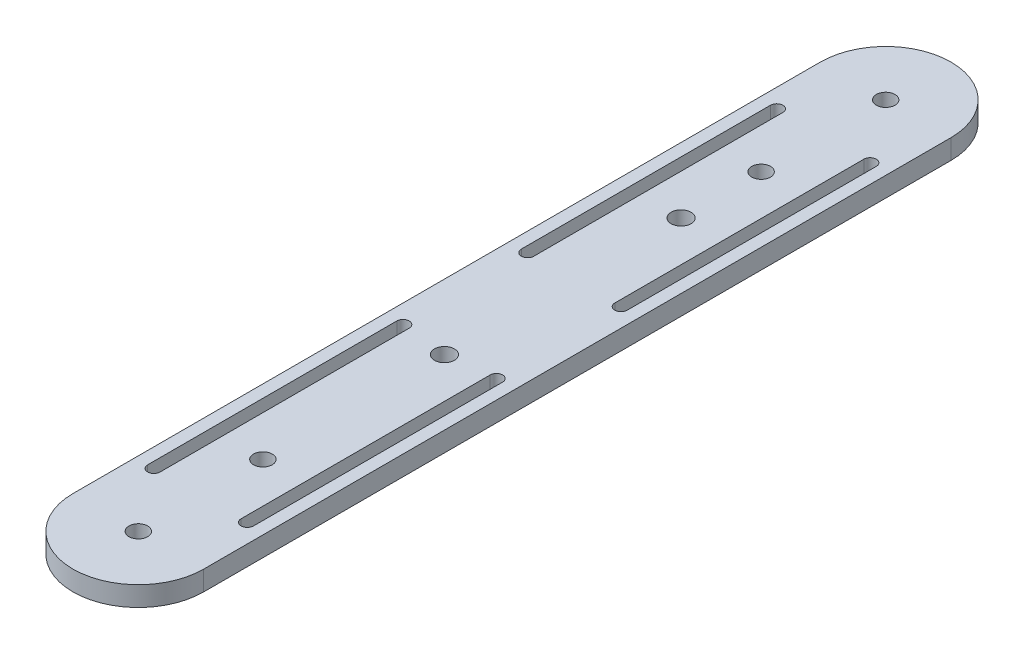
from build123d import *

# Parameters (mm, degrees)
SKETCH1_R               = 1.5
BOSS_EXTRUDE1_DEPTH     = 3.175
CUT_EXTRUDE1_DEPTH      = 131.960225355
CUT_EXTRUDE1_DEPTH_BACK = 131.960225355
SKETCH2_R               = 1.5
CUT_EXTRUDE2_DEPTH      = 131.960225355
CUT_EXTRUDE2_DEPTH_BACK = 131.960225355
SKETCH3_R               = 1.5
CUT_EXTRUDE4_DEPTH      = 40
SKETCH6_R               = 1.6
CUT_EXTRUDE5_DEPTH      = 10


with BuildPart() as part:
    # Sketch1 → Boss-Extrude1 (new body)
    with BuildSketch(Plane(origin=(0, 0, 0), x_dir=(1, 0, 0), z_dir=(0, 1, 0))):
        with BuildLine():
            Line((-10.5, 0), (-10.5, -120))
            ThreePointArc((-10.5, -120), (0, -130.5), (10.5, -120))
            Line((10.5, -120), (10.5, 0))
            ThreePointArc((10.5, 0), (0, 10.5), (-10.5, 0))
        make_face()
        Circle(SKETCH1_R, mode=Mode.SUBTRACT)
        with Locations((0, -120)):
            Circle(SKETCH1_R, mode=Mode.SUBTRACT)
    extrude(amount=BOSS_EXTRUDE1_DEPTH)

    # Sketch2 → Cut-Extrude1 (cut, two sides: drawn at the far end of the back side and taken through both)
    with BuildSketch(Plane.XZ.offset(-CUT_EXTRUDE1_DEPTH_BACK)):
        with Locations((0, 20)):
            Circle(SKETCH2_R)
    extrude(amount=CUT_EXTRUDE1_DEPTH + CUT_EXTRUDE1_DEPTH_BACK, mode=Mode.SUBTRACT)

    # Sketch3 → Cut-Extrude2 (cut, two sides: drawn at the far end of the back side and taken through both)
    with BuildSketch(Plane(origin=(0, 3.175, 0), x_dir=(1, 0, 0), z_dir=(0, 1, 0)).offset(-CUT_EXTRUDE2_DEPTH_BACK)):
        with Locations((0, -100)):
            Circle(SKETCH3_R)
    extrude(amount=CUT_EXTRUDE2_DEPTH + CUT_EXTRUDE2_DEPTH_BACK, mode=Mode.SUBTRACT)

    # Sketch5 → Cut-Extrude4 (cut)
    with BuildSketch(Plane.XZ):
        with BuildLine():
            Line((-8.5, 10), (-8.5, 50))
            ThreePointArc((-8.5, 50), (-7.5, 51), (-6.5, 50))
            Line((-6.5, 50), (-6.5, 10))
            ThreePointArc((-6.5, 10), (-7.5, 9), (-8.5, 10))
        make_face()
        with BuildLine():
            Line((6.5, 50), (6.5, 10))
            ThreePointArc((6.5, 10), (7.5, 9), (8.5, 10))
            Line((8.5, 10), (8.5, 50))
            ThreePointArc((8.5, 50), (7.5, 51), (6.5, 50))
        make_face()
        with BuildLine():
            Line((8.5, 110), (8.5, 70))
            ThreePointArc((8.5, 70), (7.5, 69), (6.5, 70))
            Line((6.5, 70), (6.5, 110))
            ThreePointArc((6.5, 110), (7.5, 111), (8.5, 110))
        make_face()
        with BuildLine():
            Line((-6.5, 70), (-6.5, 110))
            ThreePointArc((-6.5, 110), (-7.5, 111), (-8.5, 110))
            Line((-8.5, 110), (-8.5, 70))
            ThreePointArc((-8.5, 70), (-7.5, 69), (-6.5, 70))
        make_face()
    extrude(amount=-CUT_EXTRUDE4_DEPTH, mode=Mode.SUBTRACT)

    # Sketch6 → Cut-Extrude5 (cut)
    with BuildSketch(Plane.XZ):
        with Locations((0, 70.85)):
            Circle(SKETCH6_R)
        with Locations((0, 32.85)):
            Circle(SKETCH6_R)
    extrude(amount=-CUT_EXTRUDE5_DEPTH, mode=Mode.SUBTRACT)


solid = part.part
